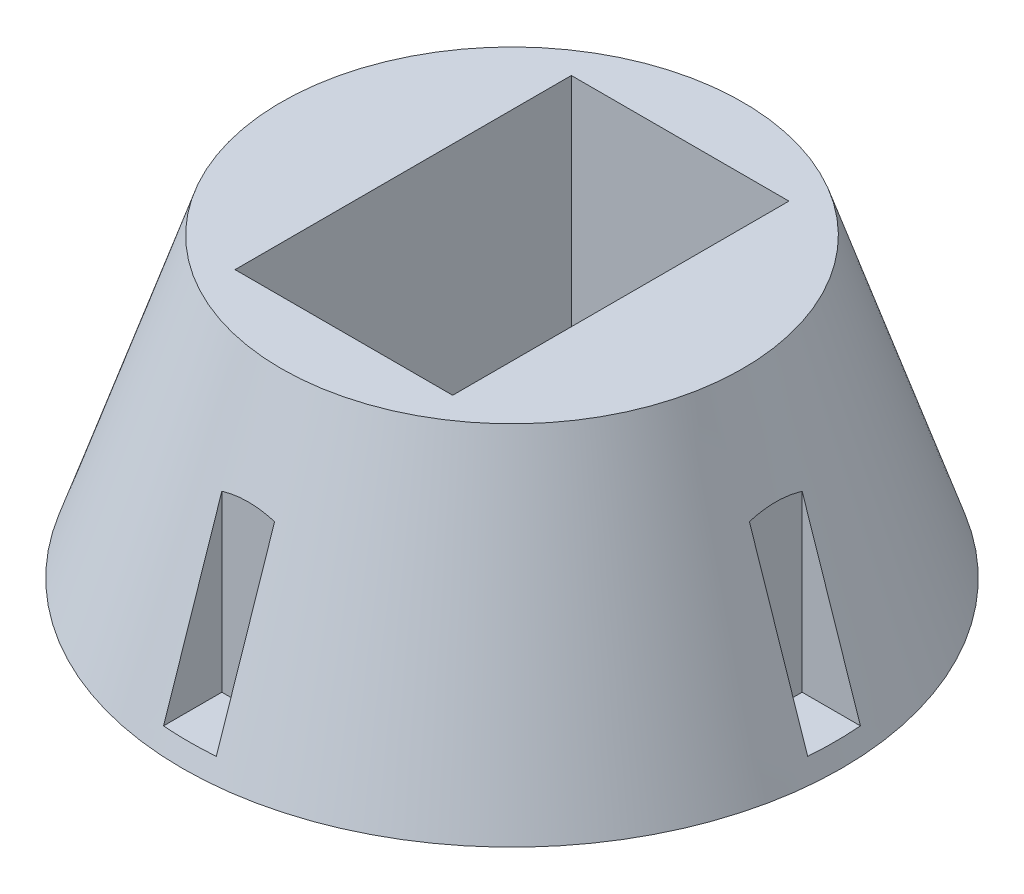
from build123d import *

# Parameters (mm, degrees)
ESQUISSE2_W             = 33
ESQUISSE2_H             = 51
ENL_V_MAT_EXTRU_1_DEPTH = 41
ESQUISSE3_W             = 8
ESQUISSE3_H             = 12
ESQUISSE3_W_2           = 12
ESQUISSE3_H_2           = 8
ENL_V_MAT_EXTRU_3_DEPTH = 42


with BuildPart() as part:
    # Esquisse1 → Révolution1 (revolve)
    with BuildSketch(Plane.XY):
        Polygon((0, 0), (-50, 0), (-35, 45), (0, 45), align=None)
    revolve(axis=Axis((0, 185.624886126, 0), (0, -1, 0)))

    # Esquisse2 → Enlèv. mat.-Extru.1 (cut)
    with BuildSketch(Plane(origin=(0, 45, 0), x_dir=(1, 0, 0), z_dir=(0, 1, 0))):
        Rectangle(ESQUISSE2_W, ESQUISSE2_H)
    extrude(amount=-ENL_V_MAT_EXTRU_1_DEPTH, mode=Mode.SUBTRACT)

    # Esquisse3 → Enlèv. mat.-Extru.3 (cut)
    with BuildSketch(Plane(origin=(0, 45, 0), x_dir=(1, 0, 0), z_dir=(0, 1, 0))):
        with Locations((0, 46)):
            Rectangle(ESQUISSE3_W, ESQUISSE3_H)
        with Locations((46, 0)):
            Rectangle(ESQUISSE3_W_2, ESQUISSE3_H_2)
        with Locations((0, -46)):
            Rectangle(ESQUISSE3_W, ESQUISSE3_H)
        with Locations((-46, 0)):
            Rectangle(ESQUISSE3_W_2, ESQUISSE3_H_2)
    extrude(amount=-ENL_V_MAT_EXTRU_3_DEPTH, mode=Mode.SUBTRACT)


solid = part.part
